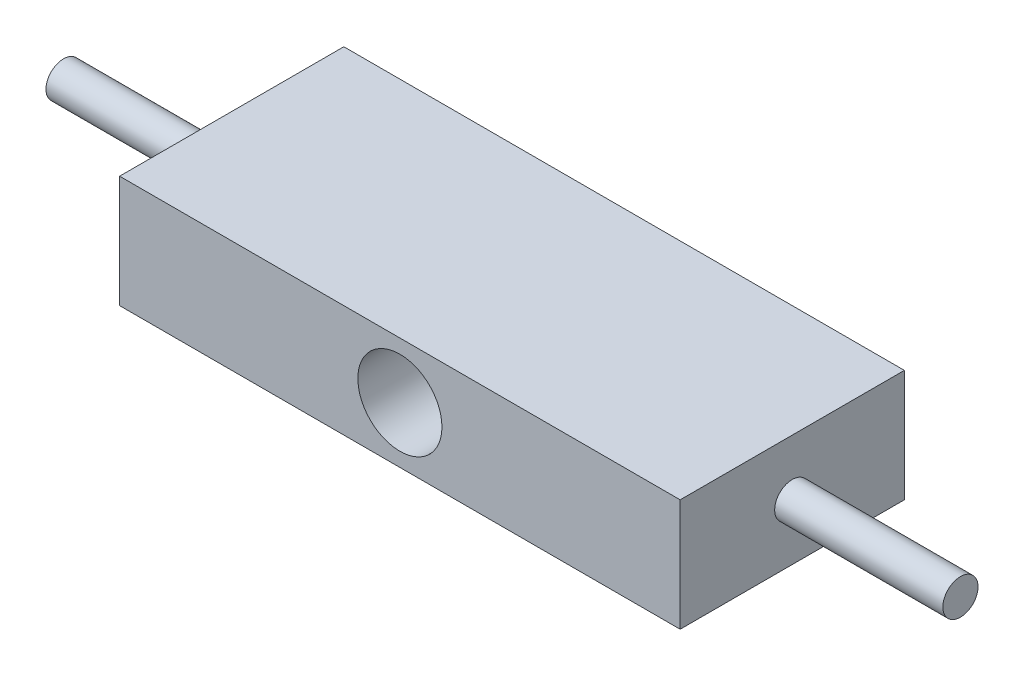
from build123d import *

# Parameters (mm, degrees)
SKETCH1_W           = 63.5
SKETCH1_H           = 12.7
SKETCH1_R           = 4.7625
BOSS_EXTRUDE1_DEPTH = 25.4
SKETCH2_R           = 1.9939
BOSS_EXTRUDE2_DEPTH = 19.05
BOSS_EXTRUDE3_START = 19.05
SKETCH3_R           = 1.9939
BOSS_EXTRUDE3_DEPTH = 19.05


with BuildPart() as part:
    # Sketch1 → Boss-Extrude1 (new body)
    with BuildSketch(Plane.XY):
        Rectangle(SKETCH1_W, SKETCH1_H)
        Circle(SKETCH1_R, mode=Mode.SUBTRACT)
    extrude(amount=-BOSS_EXTRUDE1_DEPTH)

    # Sketch2 → Boss-Extrude2 (add)
    with BuildSketch(Plane(origin=(31.75, 0, 0), x_dir=(0, 0, -1), z_dir=(1, 0, 0))):
        with Locations((12.7, 0)):
            Circle(SKETCH2_R)
    extrude(amount=BOSS_EXTRUDE2_DEPTH)

    # Sketch3 → Boss-Extrude3 (add)
    with BuildSketch(Plane.ZY.offset(31.75).offset(BOSS_EXTRUDE3_START)):
        with Locations((-12.7, 0)):
            Circle(SKETCH3_R)
    extrude(amount=-BOSS_EXTRUDE3_DEPTH)


solid = part.part
